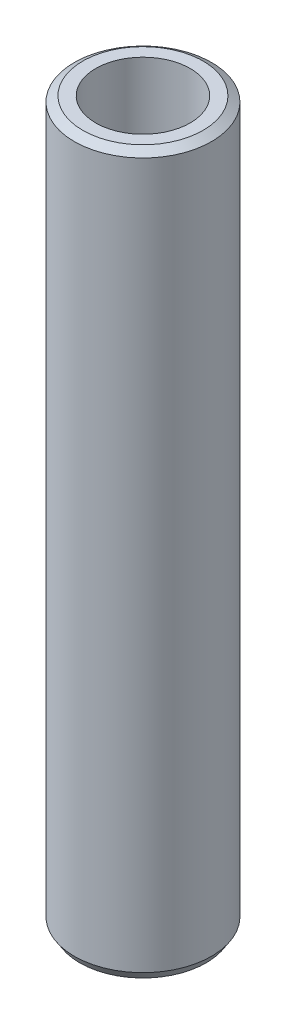
from build123d import *
from OCP.BRepFilletAPI import BRepFilletAPI_MakeChamfer

# Parameters (mm, degrees)
SKETCH1_R           = 47.5
BOSS_EXTRUDE1_DEPTH = 498.15830328
SKETCH2_R           = 32.702177313
CUT_EXTRUDE1_DEPTH  = 503.667081801
CHAMFER1_SIZE       = 3.774462321
CHAMFER1_SIZE2      = 5.878395622


with BuildPart() as part:
    # Sketch1 → Boss-Extrude1 (new body)
    with BuildSketch(Plane(origin=(0, 0, 0), x_dir=(1, 0, 0), z_dir=(0, 1, 0))):
        Circle(SKETCH1_R)
    extrude(amount=BOSS_EXTRUDE1_DEPTH)

    # Sketch2 → Cut-Extrude1 (cut, through all)
    with BuildSketch(Plane(origin=(0, 0, 0), x_dir=(1, 0, 0), z_dir=(0, 1, 0))):
        Circle(SKETCH2_R)
    extrude(amount=CUT_EXTRUDE1_DEPTH, mode=Mode.SUBTRACT)

    # Chamfer1: one chamfer whose edges measure the first distance from different faces: ONE call of the kernel's chamfer builder (chamfer() names one face for all edges)
    chamfer1_edges_1 = [part.edges().sort_by_distance(p)[0] for p in [
        (-47.5, 498.15830328, 0),
    ]]
    chamfer1_side_1 = [part.faces().sort_by_distance(p)[0] for p in [
        (-47.5, 249.07915164, 0),
    ]]
    chamfer1_edges_2 = [part.edges().sort_by_distance(p)[0] for p in [
        (-47.5, 0, 0),
    ]]
    chamfer1_side_2 = [part.faces().sort_by_distance(p)[0] for p in [
        (-46.156497116, 0, 0),
    ]]
    chamfer1 = BRepFilletAPI_MakeChamfer(part.part.solid().wrapped)
    for e in chamfer1_edges_1:
        chamfer1.Add(CHAMFER1_SIZE, CHAMFER1_SIZE2, e.wrapped, chamfer1_side_1[0].wrapped)  # the first distance lies on this face
    for e in chamfer1_edges_2:
        chamfer1.Add(CHAMFER1_SIZE, CHAMFER1_SIZE2, e.wrapped, chamfer1_side_2[0].wrapped)  # the first distance lies on this face
    add(Compound.cast(chamfer1.Shape()), mode=Mode.REPLACE)


solid = part.part
